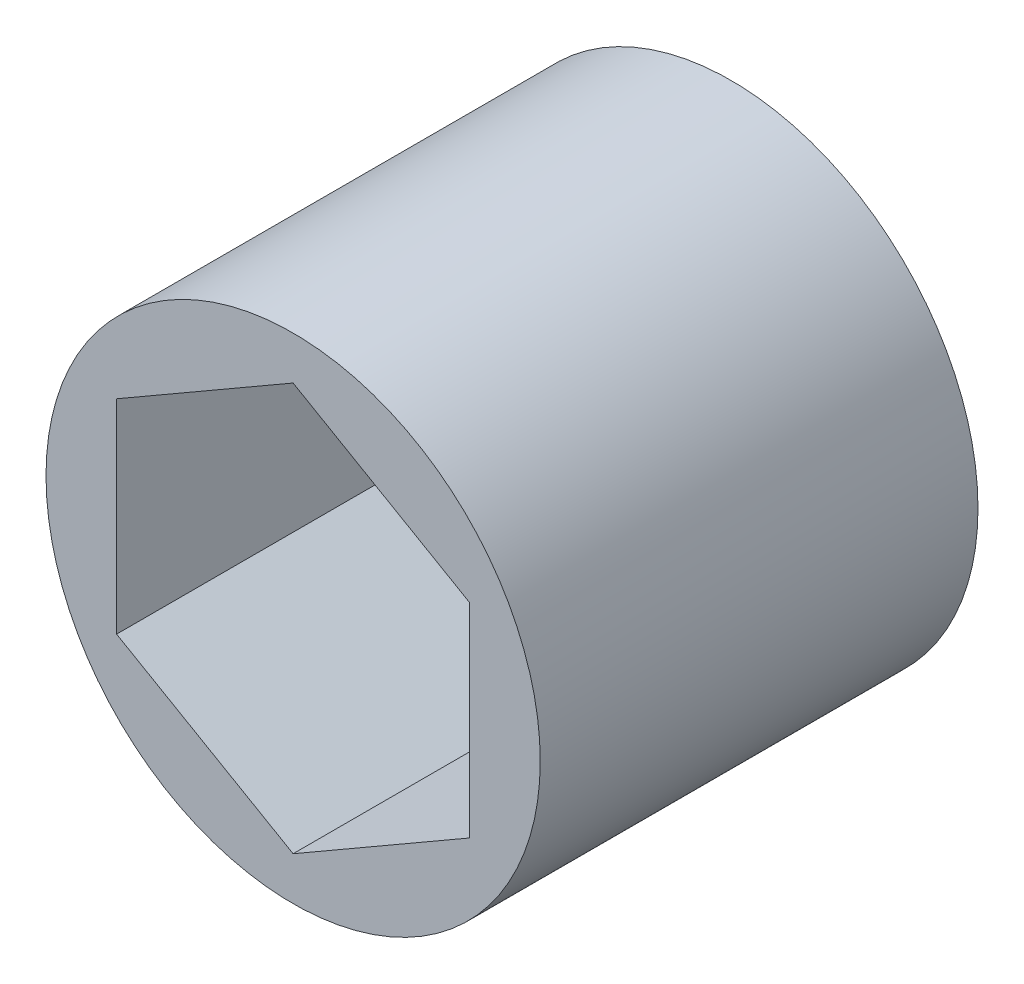
from build123d import *

# Parameters (mm, degrees)
SKETCH1_R           = 8.89
BOSS_EXTRUDE1_DEPTH = 7.874


with BuildPart() as part:
    # Sketch1 → Boss-Extrude1 (new, symmetric)
    with BuildSketch(Plane.XY):
        Circle(SKETCH1_R)
        Polygon((0, 7.332348419), (-6.35, 3.666174209), (-6.35, -3.666174209), (0, -7.332348419), (6.35, -3.666174209), (6.35, 3.666174209), align=None, mode=Mode.SUBTRACT)
    extrude(amount=BOSS_EXTRUDE1_DEPTH, both=True)


solid = part.part
